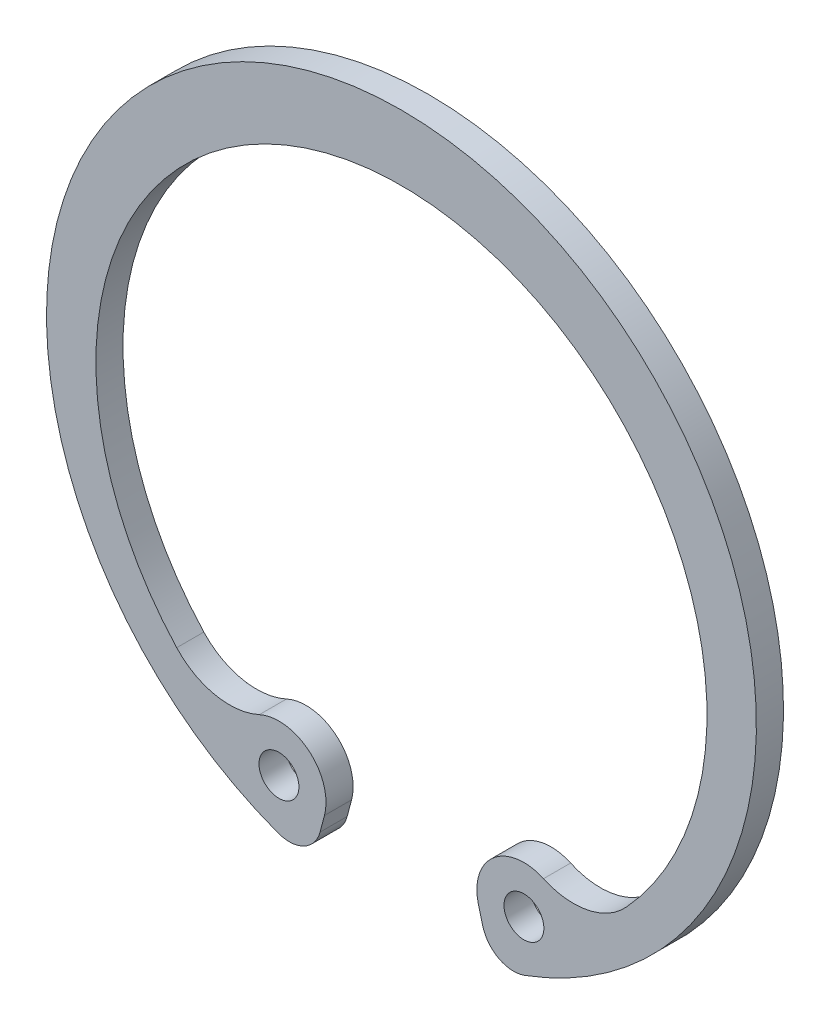
from build123d import *

# Parameters (mm, degrees)
SKETCH_3_R      = 1.25
EXTRUDE_1_DEPTH = 1.7


with BuildPart() as part:
    # Эскиз3 → Бобышка-Вытянуть1 (new body)
    with BuildSketch(Plane.XY):
        with BuildLine():
            Line((-5.100626891, -19.499714778), (-4.826258727, -18.460955514))
            ThreePointArc((-4.826258727, -18.460955514), (-5.77807992, -15.451256065), (-8.905795046, -15.02504902))
            ThreePointArc((-8.905795046, -15.02504902), (-11.666059032, -15.344520344), (-14.087724497, -13.98192885))
            ThreePointArc((-14.087724497, -13.98192885), (0, 18.15), (14.087724497, -13.98192885))
            ThreePointArc((14.087724497, -13.98192885), (11.666059032, -15.344520344), (8.905795046, -15.02504902))
            ThreePointArc((8.905795046, -15.02504902), (5.77807992, -15.451256065), (4.826258727, -18.460955514))
            Line((4.826258727, -18.460955514), (5.100626891, -19.499714778))
            ThreePointArc((5.100626891, -19.499714778), (6.112710779, -20.763976469), (7.729059109, -20.864422956))
            ThreePointArc((7.729059109, -20.864422956), (0, 22.25), (-7.729059109, -20.864422956))
            ThreePointArc((-7.729059109, -20.864422956), (-6.112710779, -20.763976469), (-5.100626891, -19.499714778))
        make_face()
        with Locations((-7.678444592, -17.707605797)):
            Circle(SKETCH_3_R, mode=Mode.SUBTRACT)
        with Locations((7.678444592, -17.707605797)):
            Circle(SKETCH_3_R, mode=Mode.SUBTRACT)
    extrude(amount=EXTRUDE_1_DEPTH)


solid = part.part
